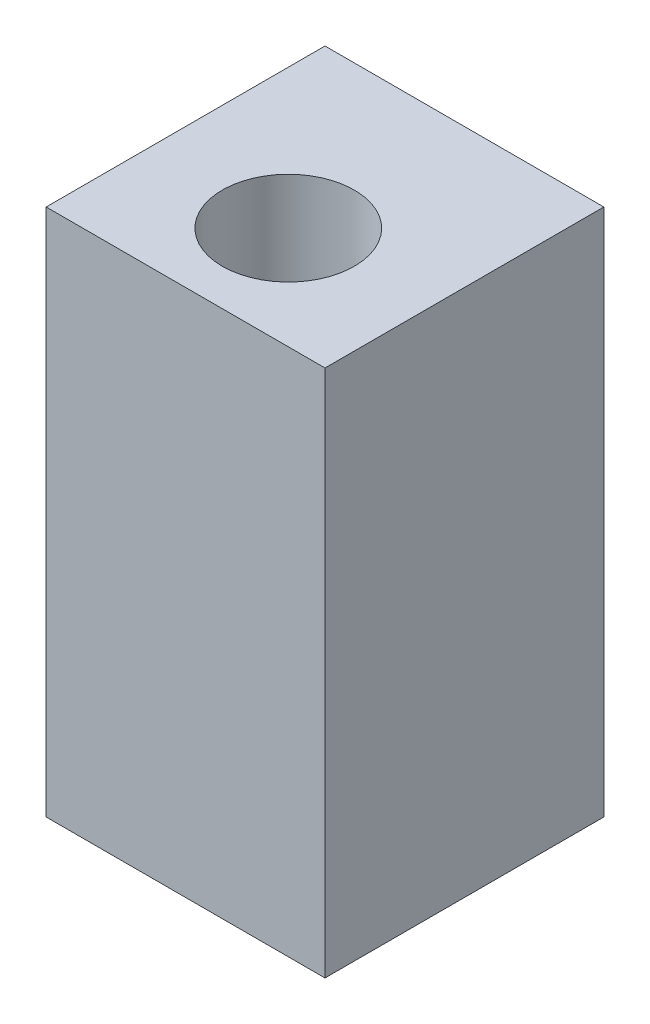
from build123d import *

# Parameters (mm, degrees)
SKETCH2_W           = 9.5
SKETCH2_H           = 9.5
BOSS_EXTRUDE1_DEPTH = 18
SKETCH3_R           = 2.25
CUT_EXTRUDE1_DEPTH  = 21


with BuildPart() as part:
    # Sketch2 → Boss-Extrude1 (new body)
    with BuildSketch(Plane(origin=(0, 0, 0), x_dir=(1, 0, 0), z_dir=(0, 1, 0))):
        Rectangle(SKETCH2_W, SKETCH2_H)
    extrude(amount=BOSS_EXTRUDE1_DEPTH)

    # Sketch3 → Cut-Extrude1 (cut)
    with BuildSketch(Plane(origin=(0, 18, 0), x_dir=(1, 0, 0), z_dir=(0, 1, 0))):
        with Locations((0, -1.25)):
            Circle(SKETCH3_R)
    extrude(amount=-CUT_EXTRUDE1_DEPTH, mode=Mode.SUBTRACT)


solid = part.part
